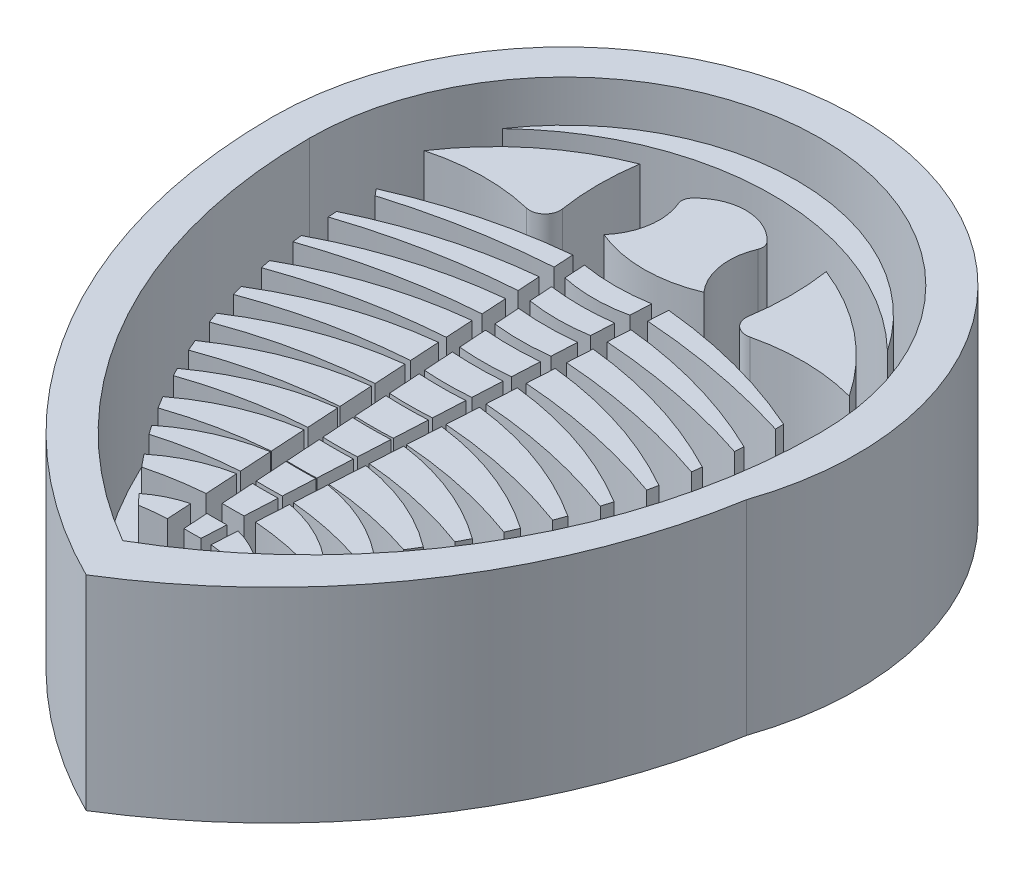
from build123d import *

# Parameters (mm, degrees)
P_IDAT_VYSUNUT_M1_DEPTH = 1
P_IDAT_VYSUNUT_M2_DEPTH = 2.5
BOSS_EXTRUDE1_START     = -4
BOSS_EXTRUDE1_DEPTH     = 4


with BuildPart() as part:
    # Skica1 → Přidat vysunutím1 (new body)
    with BuildSketch(Plane(origin=(0, 0, 0), x_dir=(1, 0, 0), z_dir=(0, 1, 0))):
        with BuildLine():
            ThreePointArc((5, 0), (0, 5), (-5, 0))
            ThreePointArc((-5, 0), (-3.660254038, -5), (0, -8.660254038))
            ThreePointArc((0, -8.660254038), (3.660254038, -5), (5, 0))
        make_face()
    extrude(amount=-P_IDAT_VYSUNUT_M1_DEPTH)

    # Skica2 → Přidat vysunutím2 (add)
    with BuildSketch(Plane(origin=(0, 0, 0), x_dir=(1, 0, 0), z_dir=(0, 1, 0))):
        with BuildLine():
            Line((-0.916308941, 0.705415762), (-0.939566009, 1.094601969))
            ThreePointArc((-0.939566009, 1.094601969), (-2.496070066, 0.816540474), (-3.987598771, 0.291787966))
            ThreePointArc((-3.987598771, 0.291787966), (-3.93376434, 0.226933977), (-3.878875249, 0.162970131))
            ThreePointArc((-3.878875249, 0.162970131), (-2.412884098, 0.517710206), (-0.916308941, 0.705415762))
        make_face()
        with BuildLine():
            ThreePointArc((3.996049018, 0.288019105), (2.500543522, 0.815361092), (0.939566009, 1.094601969))
            Line((0.939566009, 1.094601969), (0.916308941, 0.705415762))
            ThreePointArc((0.916308941, 0.705415762), (2.474795846, 0.50622373), (3.999244676, 0.125941382))
            ThreePointArc((3.999244676, 0.125941382), (3.997959641, 0.206986411), (3.996049018, 0.288019105))
        make_face()
        with BuildLine():
            Line((-0.435047938, -7.348056278), (-0.463870567, -6.865735387))
            ThreePointArc((-0.463870567, -6.865735387), (-0.820283032, -6.998144282), (-1.142178643, -7.200493427))
            ThreePointArc((-1.142178643, -7.200493427), (-1.044053725, -7.303235817), (-0.944547646, -7.404641136))
            ThreePointArc((-0.944547646, -7.404641136), (-0.69047942, -7.370211218), (-0.435047938, -7.348056278))
        make_face()
        with BuildLine():
            Line((-0.48311443, -6.543706568), (-0.52103385, -5.909159033))
            ThreePointArc((-0.52103385, -5.909159033), (-1.175976189, -6.119175526), (-1.759961506, -6.482517714))
            ThreePointArc((-1.759961506, -6.482517714), (-1.662000146, -6.605433643), (-1.56220985, -6.726869431))
            ThreePointArc((-1.56220985, -6.726869431), (-1.026754601, -6.611177456), (-0.48311443, -6.543706568))
        make_face()
        with BuildLine():
            ThreePointArc((1.759961506, -6.482517714), (1.175976189, -6.119175526), (0.52103385, -5.909159033))
            Line((0.52103385, -5.909159033), (0.48311443, -6.543706568))
            ThreePointArc((0.48311443, -6.543706568), (1.026754601, -6.611177456), (1.56220985, -6.726869431))
            ThreePointArc((1.56220985, -6.726869431), (1.662000146, -6.605433643), (1.759961506, -6.482517714))
        make_face()
        with BuildLine():
            Line((-0.525801188, -5.829381897), (-0.563062791, -5.205842323))
            ThreePointArc((-0.563062791, -5.205842323), (-1.413947855, -5.458574562), (-2.173892527, -5.917228103))
            ThreePointArc((-2.173892527, -5.917228103), (-2.111177401, -6.008129807), (-2.04750967, -6.098366866))
            ThreePointArc((-2.04750967, -6.098366866), (-1.294271561, -5.920788208), (-0.525801188, -5.829381897))
        make_face()
        with BuildLine():
            Line((-0.564221505, -5.186452286), (-0.605000226, -4.504056891))
            ThreePointArc((-0.605000226, -4.504056891), (-1.630072172, -4.78948348), (-2.550516325, -5.323359302))
            ThreePointArc((-2.550516325, -5.323359302), (-2.47902439, -5.443080103), (-2.405948876, -5.561840938))
            ThreePointArc((-2.405948876, -5.561840938), (-1.496899189, -5.31618491), (-0.564221505, -5.186452286))
        make_face()
        with BuildLine():
            ThreePointArc((2.550516325, -5.323359302), (1.630072172, -4.78948348), (0.605000226, -4.504056891))
            Line((0.605000226, -4.504056891), (0.564221505, -5.186452286))
            ThreePointArc((0.564221505, -5.186452286), (1.496899189, -5.31618491), (2.405948876, -5.561840938))
            ThreePointArc((2.405948876, -5.561840938), (2.47902439, -5.443080103), (2.550516325, -5.323359302))
        make_face()
        with BuildLine():
            ThreePointArc((2.888337343, -4.702033808), (1.82385638, -4.112337163), (0.646885649, -3.803141834))
            Line((0.646885649, -3.803141834), (0.608773859, -4.440908528))
            ThreePointArc((0.608773859, -4.440908528), (1.70684421, -4.611105365), (2.77208347, -4.927318553))
            ThreePointArc((2.77208347, -4.927318553), (2.83089034, -4.815027047), (2.888337343, -4.702033808))
        make_face()
        with BuildLine():
            Line((-0.609681174, -4.425725417), (-0.646885649, -3.803141834))
            ThreePointArc((-0.646885649, -3.803141834), (-1.82385638, -4.112337163), (-2.888337343, -4.702033808))
            ThreePointArc((-2.888337343, -4.702033808), (-2.846957116, -4.783763443), (-2.804865412, -4.865128946))
            ThreePointArc((-2.804865412, -4.865128946), (-1.722246967, -4.57062129), (-0.609681174, -4.425725417))
        make_face()
        with BuildLine():
            Line((-0.649768137, -3.75490598), (-0.688738665, -3.102769081))
            ThreePointArc((-0.688738665, -3.102769081), (-1.994758332, -3.427574113), (-3.185571439, -4.054590719))
            ThreePointArc((-3.185571439, -4.054590719), (-3.137074616, -4.168548051), (-3.087237062, -4.281925446))
            ThreePointArc((-3.087237062, -4.281925446), (-1.886992142, -3.932901443), (-0.649768137, -3.75490598))
        make_face()
        with BuildLine():
            ThreePointArc((3.185571439, -4.054590719), (1.994758332, -3.427574113), (0.688738665, -3.102769081))
            Line((0.688738665, -3.102769081), (0.649768137, -3.75490598))
            ThreePointArc((0.649768137, -3.75490598), (1.886992142, -3.932901443), (3.087237062, -4.281925446))
            ThreePointArc((3.087237062, -4.281925446), (3.137074616, -4.168548051), (3.185571439, -4.054590719))
        make_face()
        with BuildLine():
            ThreePointArc((3.440254888, -3.38250392), (2.142176753, -2.735637699), (0.730570119, -2.40275715))
            Line((0.730570119, -2.40275715), (0.693500935, -3.023076761))
            ThreePointArc((0.693500935, -3.023076761), (2.048697762, -3.217851436), (3.362758833, -3.602219899))
            ThreePointArc((3.362758833, -3.602219899), (3.402116283, -3.492576859), (3.440254888, -3.38250392))
        make_face()
        with BuildLine():
            Line((-0.693500935, -3.023076761), (-0.730570119, -2.40275715))
            ThreePointArc((-0.730570119, -2.40275715), (-2.142176753, -2.735637699), (-3.440254888, -3.38250392))
            ThreePointArc((-3.440254888, -3.38250392), (-3.402116283, -3.492576859), (-3.362758833, -3.602219899))
            ThreePointArc((-3.362758833, -3.602219899), (-2.048697762, -3.217851436), (-0.693500935, -3.023076761))
        make_face()
        with BuildLine():
            Line((-0.737644723, -2.28436999), (-0.772386499, -1.70299746))
            ThreePointArc((-0.772386499, -1.70299746), (-2.265442062, -2.036978997), (-3.650276137, -2.687358247))
            ThreePointArc((-3.650276137, -2.687358247), (-3.621750205, -2.792878944), (-3.592127328, -2.898096962))
            ThreePointArc((-3.592127328, -2.898096962), (-2.186526172, -2.490583797), (-0.737644723, -2.28436999))
        make_face()
        with BuildLine():
            ThreePointArc((3.650276137, -2.687358247), (2.265442062, -2.036978997), (0.772386499, -1.70299746))
            Line((0.772386499, -1.70299746), (0.737644723, -2.28436999))
            ThreePointArc((0.737644723, -2.28436999), (2.186526172, -2.490583797), (3.592127328, -2.898096962))
            ThreePointArc((3.592127328, -2.898096962), (3.621750205, -2.792878944), (3.650276137, -2.687358247))
        make_face()
        with BuildLine():
            ThreePointArc((3.813377604, -1.970848141), (2.363805986, -1.33206045), (0.814191928, -1.003421043))
            Line((0.814191928, -1.003421043), (0.782080688, -1.540773892))
            ThreePointArc((0.782080688, -1.540773892), (2.299279672, -1.75301782), (3.773049464, -2.17127951))
            ThreePointArc((3.773049464, -2.17127951), (3.793701377, -2.071161983), (3.813377604, -1.970848141))
        make_face()
        with BuildLine():
            Line((-0.782080688, -1.540773892), (-0.814191928, -1.003421043))
            ThreePointArc((-0.814191928, -1.003421043), (-2.363805986, -1.33206045), (-3.813377604, -1.970848141))
            ThreePointArc((-3.813377604, -1.970848141), (-3.793701377, -2.071161983), (-3.773049464, -2.17127951))
            ThreePointArc((-3.773049464, -2.17127951), (-2.299279672, -1.75301782), (-0.782080688, -1.540773892))
        make_face()
        with BuildLine():
            Line((-0.826716789, -0.793828702), (-0.855989148, -0.303981988))
            ThreePointArc((-0.855989148, -0.303981988), (-2.436429093, -0.621360254), (-3.927142449, -1.234787575))
            ThreePointArc((-3.927142449, -1.234787575), (-3.915520245, -1.329262214), (-3.903042076, -1.423627611))
            ThreePointArc((-3.903042076, -1.423627611), (-2.385752794, -1.006769816), (-0.826716789, -0.793828702))
        make_face()
        with BuildLine():
            ThreePointArc((3.927142449, -1.234787575), (2.436429093, -0.621360254), (0.855989148, -0.303981988))
            Line((0.855989148, -0.303981988), (0.826716789, -0.793828702))
            ThreePointArc((0.826716789, -0.793828702), (2.385752794, -1.006769816), (3.903042076, -1.423627611))
            ThreePointArc((3.903042076, -1.423627611), (3.915520245, -1.329262214), (3.927142449, -1.234787575))
        make_face()
        with BuildLine():
            ThreePointArc((3.988971171, -0.481127617), (2.482365461, 0.094622416), (0.897780057, 0.395351462))
            Line((0.897780057, 0.395351462), (0.871479662, -0.044762094))
            ThreePointArc((0.871479662, -0.044762094), (2.444698783, -0.253257558), (3.979415358, -0.657155804))
            ThreePointArc((3.979415358, -0.657155804), (3.984562694, -0.569161766), (3.988971171, -0.481127617))
        make_face()
        with BuildLine():
            Line((-0.871479662, -0.044762094), (-0.897780057, 0.395351462))
            ThreePointArc((-0.897780057, 0.395351462), (-2.482365461, 0.094622416), (-3.988971171, -0.481127617))
            ThreePointArc((-3.988971171, -0.481127617), (-3.984562694, -0.569161766), (-3.979415358, -0.657155804))
            ThreePointArc((-3.979415358, -0.657155804), (-2.444698783, -0.253257558), (-0.871479662, -0.044762094))
        make_face()
        with BuildLine():
            ThreePointArc((1.142178643, -7.200493427), (0.820283032, -6.998144282), (0.463870567, -6.865735387))
            Line((0.463870567, -6.865735387), (0.434044566, -7.364846815))
            ThreePointArc((0.434044566, -7.364846815), (0.674611597, -7.394792085), (0.913565558, -7.435660409))
            ThreePointArc((0.913565558, -7.435660409), (1.028790357, -7.318969583), (1.142178643, -7.200493427))
        make_face()
        with BuildLine():
            ThreePointArc((2.173892527, -5.917228103), (1.413947855, -5.458574562), (0.563062791, -5.205842323))
            Line((0.563062791, -5.205842323), (0.524857999, -5.84516532))
            ThreePointArc((0.524857999, -5.84516532), (1.275900679, -5.956649098), (2.009972467, -6.150639692))
            ThreePointArc((2.009972467, -6.150639692), (2.092725079, -6.034490511), (2.173892527, -5.917228103))
        make_face()
        with BuildLine():
            ThreePointArc((0.662066926, 1.038108349), (0.004161666, 0.983172801), (-0.653856014, 1.036744977))
            Line((-0.653856014, 1.036744977), (-0.627177875, 0.627948759))
            ThreePointArc((-0.627177875, 0.627948759), (0.007047348, 0.561342071), (0.640951077, 0.630941981))
            Line((0.640951077, 0.630941981), (0.662066926, 1.038108349))
        make_face()
        with BuildLine():
            ThreePointArc((0.626415299, 0.350655846), (0.008819368, 0.30865484), (-0.608930115, 0.348333492))
            Line((-0.608930115, 0.348333492), (-0.579458539, -0.103267301))
            ThreePointArc((-0.579458539, -0.103267301), (0.011961322, -0.148953749), (0.60307309, -0.099440312))
            Line((0.60307309, -0.099440312), (0.626415299, 0.350655846))
        make_face()
        with BuildLine():
            Line((0.56489573, -0.835595287), (0.590594924, -0.34005056))
            ThreePointArc((0.590594924, -0.34005056), (0.013466822, -0.372593507), (-0.563817169, -0.342944183))
            Line((-0.563817169, -0.342944183), (-0.531393318, -0.839783468))
            ThreePointArc((-0.531393318, -0.839783468), (0.016881591, -0.871818687), (0.56489573, -0.835595287))
        make_face()
        with BuildLine():
            Line((0.526626446, -1.573522766), (0.554661515, -1.032936542))
            ThreePointArc((0.554661515, -1.032936542), (0.018112597, -1.058353296), (-0.518578705, -1.036145198))
            Line((-0.518578705, -1.036145198), (-0.483230171, -1.577800173))
            ThreePointArc((-0.483230171, -1.577800173), (0.021803285, -1.600485761), (0.526626446, -1.573522766))
        make_face()
        with BuildLine():
            ThreePointArc((0.518646873, -1.727388889), (0.022760192, -1.747313378), (-0.473249622, -1.730734777))
            Line((-0.473249622, -1.730734777), (-0.435139253, -2.3147101))
            ThreePointArc((-0.435139253, -2.3147101), (0.026715844, -2.330778107), (0.488405798, -2.310512426))
            Line((0.488405798, -2.310512426), (0.518646873, -1.727388889))
        make_face()
        with BuildLine():
            ThreePointArc((0.482569539, -2.423050098), (0.027411133, -2.438668883), (-0.42785002, -2.42640495))
            Line((-0.42785002, -2.42640495), (-0.387270501, -3.048215708))
            ThreePointArc((-0.387270501, -3.048215708), (0.031606302, -3.059500446), (0.45035596, -3.044208443))
            Line((0.45035596, -3.044208443), (0.482569539, -2.423050098))
        make_face()
        with BuildLine():
            ThreePointArc((0.410261069, -3.817338207), (0.036726185, -3.826801141), (-0.336874511, -3.820446857))
            Line((-0.336874511, -3.820446857), (-0.296212988, -4.443514195))
            ThreePointArc((-0.296212988, -4.443514195), (0.040912963, -4.448897986), (0.377966169, -4.440064623))
            Line((0.377966169, -4.440064623), (0.410261069, -3.817338207))
        make_face()
        with BuildLine():
            Line((0.412605163, -3.77213821), (0.446439681, -3.119724092))
            ThreePointArc((0.446439681, -3.119724092), (0.032066228, -3.131924709), (-0.382390558, -3.122992379))
            Line((-0.382390558, -3.122992379), (-0.339782943, -3.775880184))
            ThreePointArc((-0.339782943, -3.775880184), (0.036459149, -3.783668202), (0.412605163, -3.77213821))
        make_face()
        with BuildLine():
            Line((0.305409141, -5.839145549), (0.337737111, -5.215781462))
            ThreePointArc((0.337737111, -5.215781462), (0.046065788, -5.221258982), (-0.245643058, -5.218410675))
            Line((-0.245643058, -5.218410675), (-0.20495555, -5.841876176))
            ThreePointArc((-0.20495555, -5.841876176), (0.050245349, -5.843978529), (0.305409141, -5.839145549))
        make_face()
        with BuildLine():
            Line((0.338653865, -5.198104154), (0.374030936, -4.51594575))
            ThreePointArc((0.374030936, -4.51594575), (0.041392047, -4.523203734), (-0.291297367, -4.51883756))
            Line((-0.291297367, -4.51883756), (-0.246767591, -5.20117915))
            ThreePointArc((-0.246767591, -5.20117915), (0.045968856, -5.204538098), (0.338653865, -5.198104154))
        make_face()
        with BuildLine():
            ThreePointArc((0.301348943, -5.917436324), (0.050751597, -5.92147661), (-0.199872475, -5.919765477))
            Line((-0.199872475, -5.919765477), (-0.158480757, -6.55402178))
            ThreePointArc((-0.158480757, -6.55402178), (0.054999827, -6.555115225), (0.268455851, -6.551697388))
            Line((0.268455851, -6.551697388), (0.301348943, -5.917436324))
        make_face()
        with BuildLine():
            ThreePointArc((0.251838147, -6.872128272), (0.057127362, -6.874661622), (-0.137598784, -6.8740018))
            Line((-0.137598784, -6.8740018), (-0.106128968, -7.356222162))
            ThreePointArc((-0.106128968, -7.356222162), (0.060356742, -7.356571612), (0.226828381, -7.354379088))
            Line((0.226828381, -7.354379088), (0.251838147, -6.872128272))
        make_face()
        with BuildLine():
            ThreePointArc((-3.772330851, 2.547069838), (0, 4.070537807), (3.772330851, 2.547069838))
            ThreePointArc((3.772330851, 2.547069838), (0, 4.5517079), (-3.772330851, 2.547069838))
        make_face()
        with BuildLine():
            ThreePointArc((-1.822084639, 1.775573316), (-1.881947184, 2.534148909), (-1.826006026, 3.293023761))
            ThreePointArc((-1.826006026, 3.293023761), (-3.13913069, 2.530148747), (-4.162667451, 1.408254291))
            ThreePointArc((-4.162667451, 1.408254291), (-3.177280617, 1.546631075), (-2.188227529, 1.437501174))
            ThreePointArc((-2.188227529, 1.437501174), (-1.914977273, 1.508870723), (-1.822084639, 1.775573316))
        make_face()
        with BuildLine():
            ThreePointArc((2.188227529, 1.437501174), (3.177280617, 1.546631075), (4.162667451, 1.408254291))
            ThreePointArc((4.162667451, 1.408254291), (3.13913069, 2.530148747), (1.826006026, 3.293023761))
            ThreePointArc((1.826006026, 3.293023761), (1.881947184, 2.534148909), (1.822084639, 1.775573316))
            ThreePointArc((1.822084639, 1.775573316), (1.914977273, 1.508870723), (2.188227529, 1.437501174))
        make_face()
        with BuildLine():
            ThreePointArc((-0.777989506, 3.004550275), (-0.696842448, 2.345663458), (-0.978400549, 1.744463226))
            ThreePointArc((-0.978400549, 1.744463226), (0, 1.547069838), (0.978400549, 1.744463226))
            ThreePointArc((0.978400549, 1.744463226), (0.696842448, 2.345663458), (0.777989506, 3.004550275))
            ThreePointArc((0.777989506, 3.004550275), (0.791260451, 3.115919535), (0.7424957, 3.216920669))
            ThreePointArc((0.7424957, 3.216920669), (0, 3.547069838), (-0.7424957, 3.216920669))
            ThreePointArc((-0.7424957, 3.216920669), (-0.791260451, 3.115919535), (-0.777989506, 3.004550275))
        make_face()
    extrude(amount=P_IDAT_VYSUNUT_M2_DEPTH)

    # Sketch1 → Boss-Extrude1 (add)
    with BuildSketch(Plane.XZ.offset(1).offset(BOSS_EXTRUDE1_START)):
        with BuildLine():
            ThreePointArc((0.221158993, 9.598638949), (-4.116252851, 5.644920283), (-5.722461986, 0))
            ThreePointArc((-5.722461986, 0), (0.938853651, -5.644920283), (5.414396618, 1.8522636))
            ThreePointArc((5.414396618, 1.8522636), (3.655025868, 6.286749681), (0.221158993, 9.598638949))
        make_face()
        with BuildLine():
            ThreePointArc((5, 0), (0, -5), (-5, 0))
            ThreePointArc((-5, 0), (-3.660254038, 5), (0, 8.660254038))
            ThreePointArc((0, 8.660254038), (3.660254038, 5), (5, 0))
        make_face(mode=Mode.SUBTRACT)
    extrude(amount=BOSS_EXTRUDE1_DEPTH)


solid = part.part
